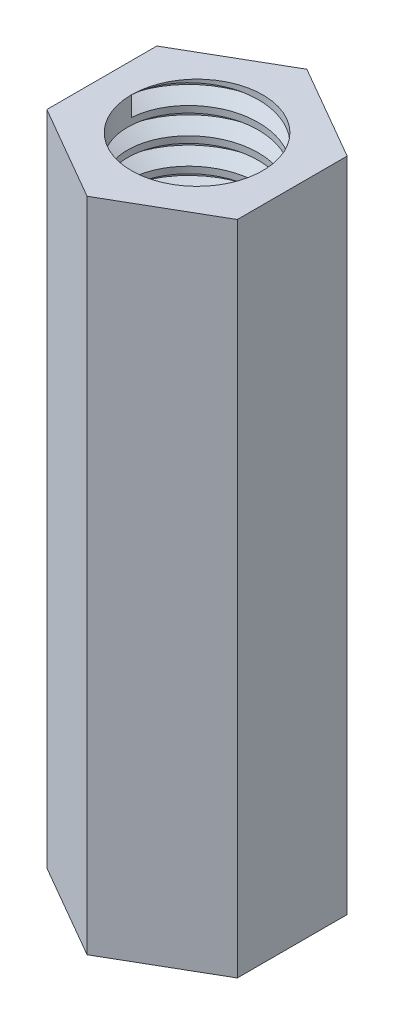
from build123d import *

# Parameters (mm, degrees)
BOSS_EXTRUDE1_DEPTH = 10
SKETCH2_R           = 1
CUT_EXTRUDE1_DEPTH  = 10
THREAD1_PITCH       = 0.4


with BuildPart() as part:
    # Sketch1 → Boss-Extrude1 (new body)
    with BuildSketch(Plane(origin=(0, 0, 0), x_dir=(1, 0, 0), z_dir=(0, 1, 0))):
        Polygon((13.736774352, -0.795542916), (15.186779358, 0.041617865), (15.186779358, 1.713596228), (13.734755096, 2.551922827), (12.286779358, 1.715933645), (12.286779358, 0.041612084), align=None)
    extrude(amount=BOSS_EXTRUDE1_DEPTH)

    # Sketch2 → Cut-Extrude1 (cut)
    with BuildSketch(Plane(origin=(0, 10, 0), x_dir=(1, 0, 0), z_dir=(0, 1, 0))):
        with Locations(Location((13.73677769, 0.878772865, 0), (0, 0, 270))):
            Circle(SKETCH2_R)
    extrude(amount=-CUT_EXTRUDE1_DEPTH, mode=Mode.SUBTRACT)

    # Thread1: the profile of Thread Profile1 profile screwed along a right-hand helix of 25 turns, 6 arcs to a turn; built about Z, then put on its axis
    thread1_z = Axis((0, 0, 0), (0, 0, 1))
    thread1_corners = [(0.9997, 0, -0.000173205), (1.21650635, 0, 0.124999999), (1.21650635, 0, 0.174999999), (0.9997, 0, 0.300173204)]
    with BuildLine(mode=Mode.PRIVATE) as thread1_profile:
        Line(thread1_corners[0], thread1_corners[1])
        Line(thread1_corners[1], thread1_corners[2])
        Line(thread1_corners[2], thread1_corners[3])
        Line(thread1_corners[3], thread1_corners[0])
    thread1_cap = Face(thread1_profile.wire())
    thread1_turn_angles = [0, 30, 60, 90, 120, 150, 180, 210, 240, 270, 300, 330, 360]
    thread1_turn_weights = [1, 0.8660254037844387, 1, 0.8660254037844387, 1, 0.8660254037844387, 1, 0.8660254037844387, 1, 0.8660254037844387, 1, 0.8660254037844387, 1]
    thread1_turn_rails = [Edge.make_bspline([Vector(p[0], p[1], 0).rotate(thread1_z, thread1_turn_angles[k]) / thread1_turn_weights[k] + Vector(0, 0, p[2] + THREAD1_PITCH * thread1_turn_angles[k] / 360) for k in range(13)], [0, 0, 0, 1, 1, 2, 2, 3, 3, 4, 4, 5, 5, 6, 6, 6], 2, thread1_turn_weights) for p in thread1_corners]
    thread1_turn_sides = [Face.make_surface_from_curves(thread1_turn_rails[p[0]], thread1_turn_rails[p[1]]) for p in [(0, 1), (1, 2), (2, 3), (3, 0)]]
    thread1 = Plane(origin=(13.73677769, 10, -0.878772865), x_dir=(-1, 0, 0), z_dir=(0, -1, 0)) * Solid(Shell([*[p.moved(Location((0, 0, THREAD1_PITCH * i))) for i in range(25) for p in thread1_turn_sides], thread1_cap, thread1_cap.rotate(thread1_z, 9000).moved(Location((0, 0, THREAD1_PITCH * 9000 / 360)))]))
    add(thread1, mode=Mode.SUBTRACT)


solid = part.part
